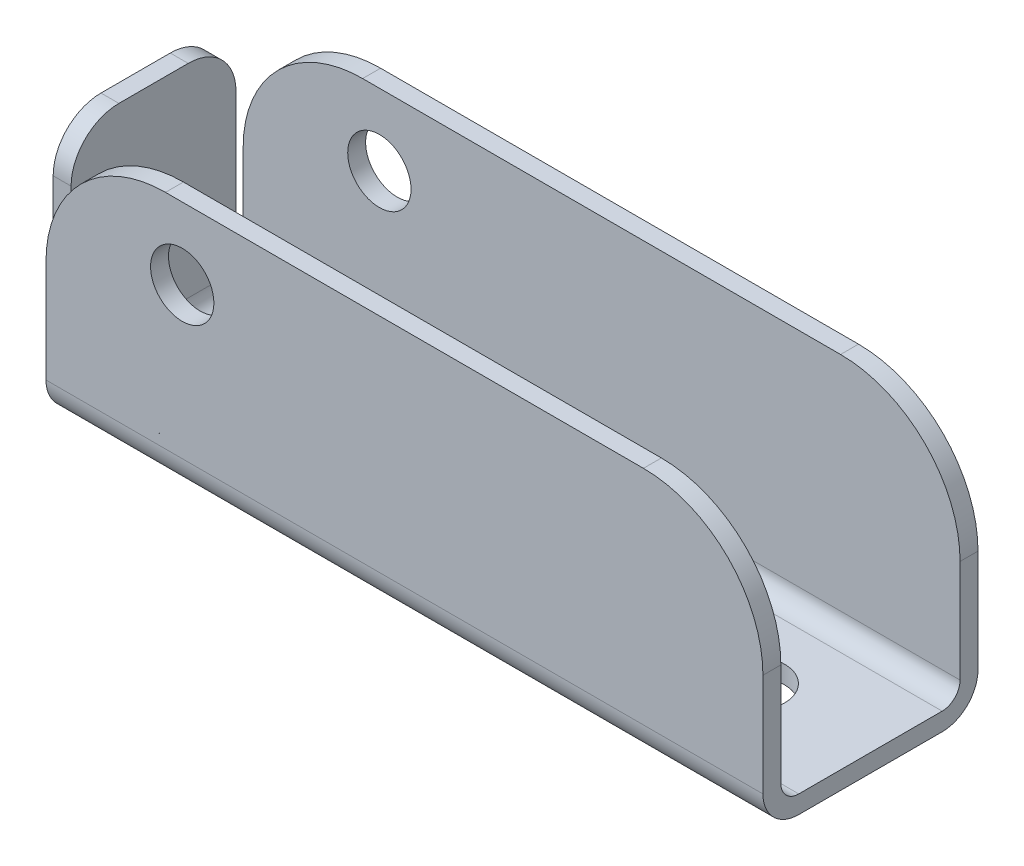
from build123d import *

# Parameters (mm, degrees)
SKETCH1_W           = 78.105
SKETCH1_H           = 22.86
BOSS_EXTRUDE1_DEPTH = 1.905
SKETCH2_W           = 76.2
SKETCH2_H           = 1.905
BOSS_EXTRUDE2_DEPTH = 25.527
SKETCH5_W           = 1.905
SKETCH5_H           = 17.526
BOSS_EXTRUDE6_DEPTH = 23.495
SKETCH6_W           = 1.905
SKETCH6_H           = 2.667
CUT_EXTRUDE2_DEPTH  = 25.4
SKETCH7_R           = 3.5687
CUT_EXTRUDE3_DEPTH  = 25.4
SKETCH8_R           = 3.3655
CUT_EXTRUDE4_DEPTH  = 25.4
FILLET1_R           = 12.7
FILLET2_R           = 5.08
FILLET3_R           = 3.81
FILLET4_R           = 1.905
FILLET5_R           = 3.81
FILLET6_START       = 1.905
FILLET6_DEPTH       = 76.2


with BuildPart() as part:
    # Sketch1 → Boss-Extrude1 (new body)
    with BuildSketch(Plane(origin=(0, 0, 0), x_dir=(1, 0, 0), z_dir=(0, 1, 0))):
        with Locations((39.0525, 0)):
            Rectangle(SKETCH1_W, SKETCH1_H)
    extrude(amount=BOSS_EXTRUDE1_DEPTH)

    # Sketch2 → Boss-Extrude2 (add)
    with BuildSketch(Plane(origin=(0, 1.905, 0), x_dir=(1, 0, 0), z_dir=(0, 1, 0))):
        with Locations((40.005, -10.4775)):
            Rectangle(SKETCH2_W, SKETCH2_H)
        with Locations((40.005, 10.4775)):
            Rectangle(SKETCH2_W, SKETCH2_H)
    extrude(amount=BOSS_EXTRUDE2_DEPTH)

    # Sketch5 → Boss-Extrude6 (add)
    with BuildSketch(Plane(origin=(0, 1.905, 0), x_dir=(1, 0, 0), z_dir=(0, 1, 0))):
        with Locations((0.9525, 0)):
            Rectangle(SKETCH5_W, SKETCH5_H)
    extrude(amount=BOSS_EXTRUDE6_DEPTH)

    # Sketch6 → Cut-Extrude2 (cut)
    with BuildSketch(Plane(origin=(0, 1.905, 0), x_dir=(1, 0, 0), z_dir=(0, 1, 0))):
        with Locations((0.9525, -10.0965)):
            Rectangle(SKETCH6_W, SKETCH6_H)
        with Locations((0.9525, 10.0965)):
            Rectangle(SKETCH6_W, SKETCH6_H)
    extrude(amount=-CUT_EXTRUDE2_DEPTH, mode=Mode.SUBTRACT)

    # Sketch7 → Cut-Extrude3 (cut)
    with BuildSketch(Plane(origin=(0, 1.905, 0), x_dir=(1, 0, 0), z_dir=(0, 1, 0))):
        with Locations(Location((65.405, 0, 0), (0, 0, 270))):
            Circle(SKETCH7_R)
        with Locations(Location((27.305, 0, 0), (0, 0, 270))):
            Circle(SKETCH7_R)
    extrude(amount=-CUT_EXTRUDE3_DEPTH, mode=Mode.SUBTRACT)

    # Sketch8 → Cut-Extrude4 (cut)
    with BuildSketch(Plane.XY.offset(11.43)):
        with Locations((16.383, 19.812)):
            Circle(SKETCH8_R)
    extrude(amount=-CUT_EXTRUDE4_DEPTH, mode=Mode.SUBTRACT)

    # Fillet1
    fillet1_edges = [part.edges().sort_by_distance(p)[0] for p in [
        (78.105, 27.432, 10.4775),
        (1.905, 27.432, 10.4775),
        (1.905, 27.432, -10.4775),
        (78.105, 27.432, -10.4775),
    ]]
    fillet(fillet1_edges, radius=FILLET1_R)

    # Fillet2
    fillet2_edges = [part.edges().sort_by_distance(p)[0] for p in [
        (0.9525, 25.4, -8.763),
        (0.9525, 25.4, 8.763),
    ]]
    fillet(fillet2_edges, radius=FILLET2_R)

    # Fillet3
    fillet3_edges = [part.edges().sort_by_distance(p)[0] for p in [
        (0, 0, 0),
    ]]
    fillet(fillet3_edges, radius=FILLET3_R)

    # Fillet4
    fillet4_edges = [part.edges().sort_by_distance(p)[0] for p in [
        (1.905, 1.905, 0),
    ]]
    fillet(fillet4_edges, radius=FILLET4_R)

    # Fillet5
    # the kernel refuses this fillet: 3.81 mm, written as the material it takes off along each edge
    with BuildSketch(Plane(origin=(-5.715, 0, -11.43), x_dir=(0, 0, 1), z_dir=(1, 0, 0))) as fillet5_piece_1:
        with BuildLine():
            CenterArc((FILLET5_R, -FILLET5_R), FILLET5_R, 90, 90)
            Line((0, -FILLET5_R), (0, 0))
            Line((0, 0), (FILLET5_R, 0))
        make_face()
    extrude(amount=93.345, mode=Mode.SUBTRACT)
    with BuildSketch(Plane(origin=(87.63, 0, 11.43), x_dir=(0, 1, 0), z_dir=(-1, 0, 0))) as fillet5_piece_2:
        with BuildLine():
            CenterArc((FILLET5_R, FILLET5_R), FILLET5_R, 180, 90)
            Line((0, FILLET5_R), (0, 0))
            Line((0, 0), (FILLET5_R, 0))
        make_face()
    extrude(amount=93.345, mode=Mode.SUBTRACT)

    # Fillet6: read off the stored shape, not the designer's step
    # Fillet6 outline → Fillet6 (add)
    with BuildSketch(Plane.YZ.offset(FILLET6_START)):
        with BuildLine():
            Line((1.905, -7.62), (1.905, -9.525))
            Line((1.905, -9.525), (3.81, -9.525))
            ThreePointArc((3.81, -9.525), (2.462961582, -8.967038418), (1.905, -7.62))
        make_face()
        with BuildLine():
            Line((3.81, 9.525), (1.905, 9.525))
            Line((1.905, 9.525), (1.905, 7.62))
            ThreePointArc((1.905, 7.62), (2.462961582, 8.967038418), (3.81, 9.525))
        make_face()
    extrude(amount=FILLET6_DEPTH)


solid = part.part
